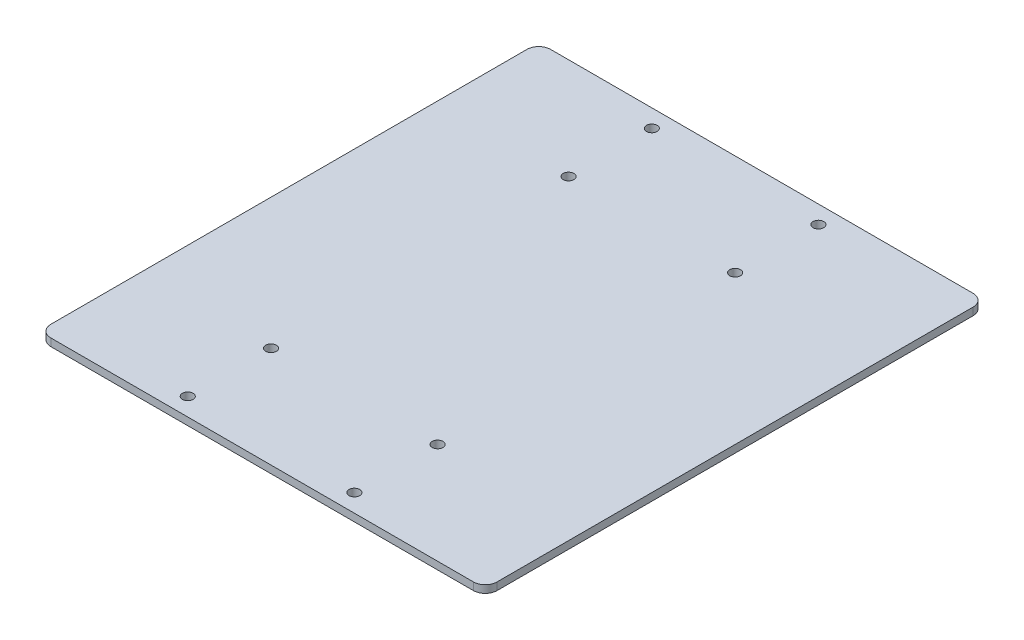
from build123d import *

# Parameters (mm, degrees)
SKETCH1_W            = 375
SKETCH1_H            = 420
BOSS_EXTRUDE1_DEPTH  = 6.35
FILLET1_R            = 10
M8_CLEARANCE_HOLE1_D = 9


with BuildPart() as part:
    # Sketch1 → Boss-Extrude1 (new body)
    with BuildSketch(Plane(origin=(0, 0, 0), x_dir=(1, 0, 0), z_dir=(0, 1, 0))):
        Rectangle(SKETCH1_W, SKETCH1_H)
    extrude(amount=BOSS_EXTRUDE1_DEPTH)

    # Fillet1
    fillet1_edges = [part.edges().sort_by_distance(p)[0] for p in [
        (-187.5, 3.175, -210),
        (187.5, 3.175, -210),
        (187.5, 3.175, 210),
        (-187.5, 3.175, 210),
    ]]
    fillet(fillet1_edges, radius=FILLET1_R)

    # M8 Clearance Hole1 (through all)
    with Locations(Plane(origin=(0, 6.35, 0), x_dir=(1, 0, 0), z_dir=(0, 1, 0))):
        with Locations((-77.5, -195), (62.5, -125), (-77.5, -125), (62.5, -195)):
            m8_clearance_hole1 = Hole(M8_CLEARANCE_HOLE1_D / 2)

    # Mirror1: M8 Clearance Hole1 across plane
    add(m8_clearance_hole1.mirror(Plane.XY), mode=Mode.SUBTRACT)


solid = part.part
